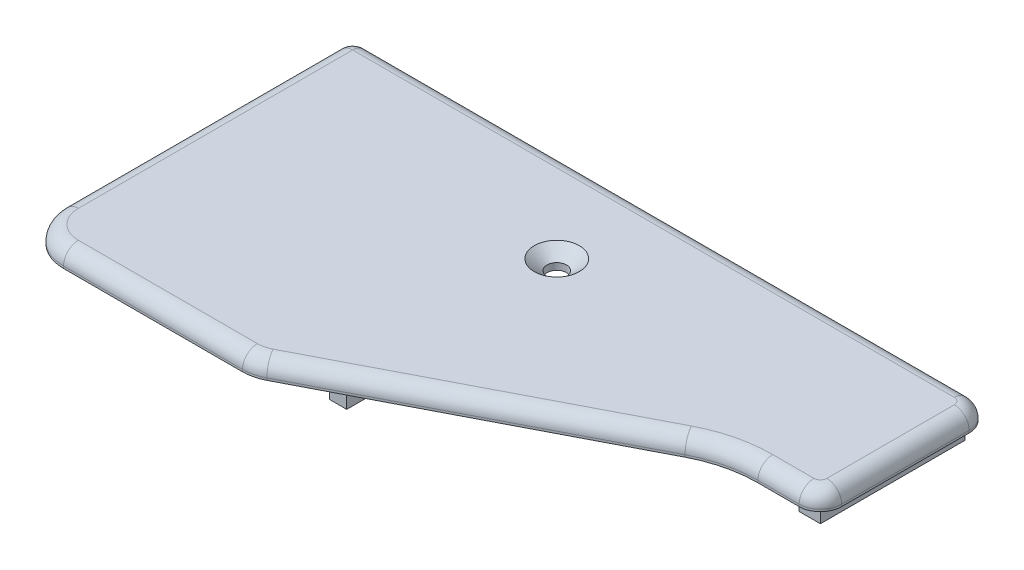
from build123d import *

# Parameters (mm, degrees)
SKETCH1_R           = 1.4605
BOSS_EXTRUDE1_DEPTH = 2.54
SKETCH12_W          = 3.175
SKETCH12_H          = 21.59
BOSS_EXTRUDE7_DEPTH = 2.54
FILLET6_R           = 19.05
FILLET7_R           = 6.35
FILLET8_R           = 3.175
FILLET9_R           = 2.2225
CHAMFER1_SIZE       = 1.905
CHAMFER1_SIZE2      = 1.542638583
FILLET10_R          = 2.2225
SKETCH13_W          = 2.54
SKETCH13_H          = 9.525
BOSS_EXTRUDE8_DEPTH = 15.24
FILLET11_R          = 2.54
SKETCH14_R          = 3.175
CUT_EXTRUDE1_DEPTH  = 85.947716862


with BuildPart() as part:
    # Sketch1 → Boss-Extrude1 (new body)
    with BuildSketch(Plane(origin=(0, 0, 0), x_dir=(1, 0, 0), z_dir=(0, 1, 0))):
        Polygon((0, 0), (95.25, 0), (95.25, -25.4), (81.28, -25.4), (44.45, -44.45), (34.628666667, -49.53), (0, -49.53), (0, -44.45), align=None)
        with Locations((44.45, -13.97)):
            Circle(SKETCH1_R, mode=Mode.SUBTRACT)
    extrude(amount=BOSS_EXTRUDE1_DEPTH)

    # Sketch12 → Boss-Extrude7 (add)
    with BuildSketch(Plane.XZ):
        with Locations((91.7575, 12.7)):
            Rectangle(SKETCH12_W, SKETCH12_H)
    extrude(amount=BOSS_EXTRUDE7_DEPTH)

    # Fillet6
    fillet6_edges = [part.edges().sort_by_distance(p)[0] for p in [
        (81.28, 1.27, 25.4),
    ]]
    fillet(fillet6_edges, radius=FILLET6_R)

    # Fillet7
    fillet7_edges = [part.edges().sort_by_distance(p)[0] for p in [
        (0, 1.27, 49.53),
        (34.628666667, 1.27, 49.53),
    ]]
    fillet(fillet7_edges, radius=FILLET7_R)

    # Fillet8
    fillet8_edges = [part.edges().sort_by_distance(p)[0] for p in [
        (95.25, 1.27, 0),
        (95.25, 1.27, 25.4),
    ]]
    fillet(fillet8_edges, radius=FILLET8_R)

    # Fillet9
    fillet9_edges = [part.edges().sort_by_distance(p)[0] for p in [
        (0, 1.27, 0),
    ]]
    fillet(fillet9_edges, radius=FILLET9_R)

    # Chamfer1
    chamfer1_edges = [part.edges().sort_by_distance(p)[0] for p in [
        (42.9895, 2.54, 13.97),
    ]]
    chamfer1_side = [part.faces().sort_by_distance(p)[0] for p in [
        (41.421999289, 2.54, 21.145861344),
    ]]
    chamfer(chamfer1_edges, length=CHAMFER1_SIZE, length2=CHAMFER1_SIZE2, reference=chamfer1_side[0])

    # Fillet10
    fillet10_edges = [part.edges().sort_by_distance(p)[0] for p in [
        (0.650955179, 2.54, 0.650955179),
        (47.14875, 2.54, 0),
        (94.32006403, 2.54, 0.92993597),
        (95.25, 2.54, 12.7),
        (94.32006403, 2.54, 24.47006403),
        (88.995031201, 2.54, 25.4),
        (81.411391857, 2.54, 25.940017514),
        (56.582018599, 2.54, 38.174817966),
        (34.584869381, 2.54, 49.349994162),
        (19.716822933, 2.54, 49.53),
        (1.859871939, 2.54, 47.670128061),
        (0, 2.54, 22.70125),
    ]]
    fillet(fillet10_edges, radius=FILLET10_R)

    # Sketch13 → Boss-Extrude8 (add)
    with BuildSketch(Plane.XZ):
        with Locations((29.21, 26.6065)):
            Rectangle(SKETCH13_W, SKETCH13_H)
    extrude(amount=BOSS_EXTRUDE8_DEPTH)

    # Fillet11
    fillet11_edges = [part.edges().sort_by_distance(p)[0] for p in [
        (29.21, 0, 21.844),
        (30.48, 0, 26.6065),
        (29.21, 0, 31.369),
        (27.94, 0, 26.6065),
    ]]
    fillet(fillet11_edges, radius=FILLET11_R)

    # Sketch14 → Cut-Extrude1 (cut, through all)
    with BuildSketch(Plane.ZY.offset(-27.94)):
        with Locations((26.6065, -8.89)):
            Circle(SKETCH14_R)
    extrude(amount=-CUT_EXTRUDE1_DEPTH, mode=Mode.SUBTRACT)


solid = part.part
